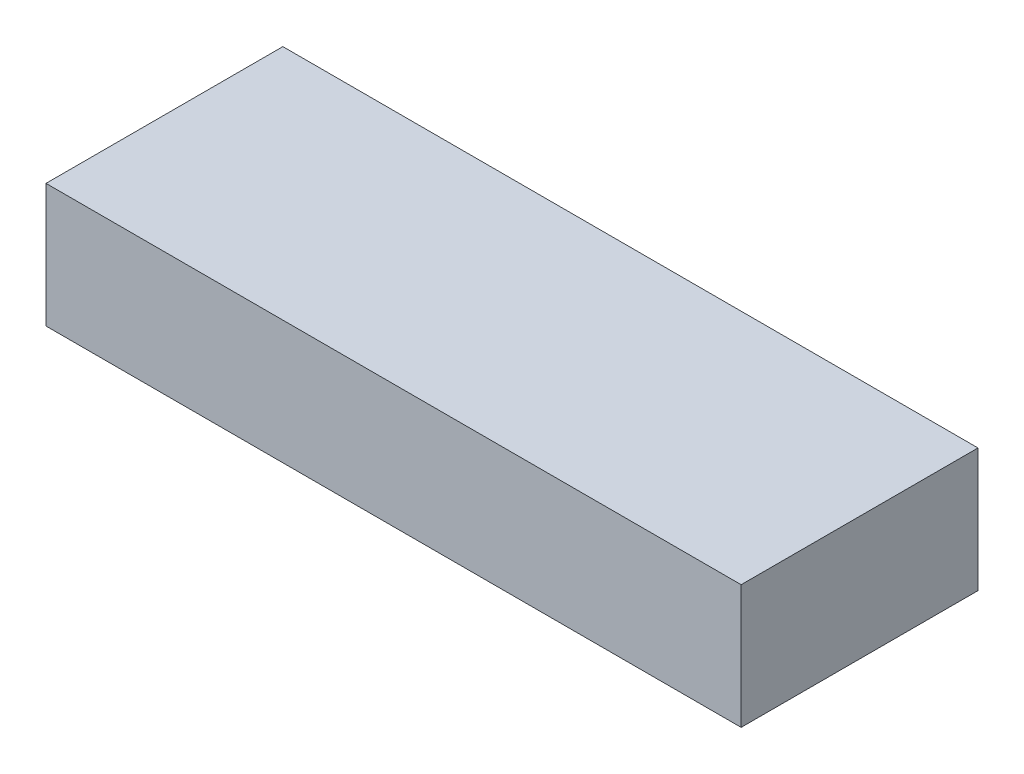
from build123d import *

# Parameters (mm, degrees)
SKETCH1_W           = 135
SKETCH1_H           = 46
BOSS_EXTRUDE1_DEPTH = 12


with BuildPart() as part:
    # Sketch1 → Boss-Extrude1 (new, symmetric)
    with BuildSketch(Plane(origin=(0, 0, 0), x_dir=(1, 0, 0), z_dir=(0, 1, 0))):
        Rectangle(SKETCH1_W, SKETCH1_H)
    extrude(amount=BOSS_EXTRUDE1_DEPTH, both=True)


solid = part.part
